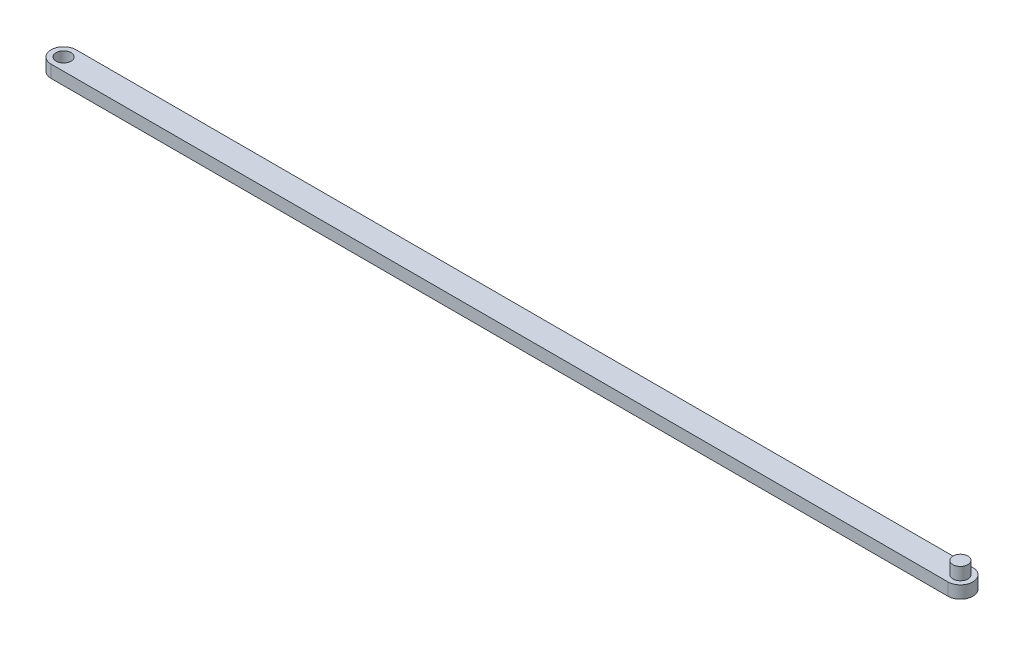
from build123d import *

# Parameters (mm, degrees)
SKETCH_1_R      = 3
EXTRUDE_1_DEPTH = 5
SKETCH_2_R      = 3
EXTRUDE_2_DEPTH = 5


with BuildPart() as part:
    # 草图1 → 凸台-拉伸1 (new body)
    with BuildSketch(Plane(origin=(0, 0, 0), x_dir=(1, 0, 0), z_dir=(0, 1, 0))):
        with BuildLine():
            Line((0, 0), (359.9, 0))
            ThreePointArc((359.9, 0), (364.9, -5), (359.9, -10))
            Line((359.9, -10), (0, -10))
            ThreePointArc((0, -10), (-5, -5), (0, 0))
        make_face()
        with Locations((0, -5)):
            Circle(SKETCH_1_R, mode=Mode.SUBTRACT)
    extrude(amount=EXTRUDE_1_DEPTH)

    # 草图2 → 凸台-拉伸2 (add)
    with BuildSketch(Plane(origin=(0, 5, 0), x_dir=(1, 0, 0), z_dir=(0, 1, 0))):
        with Locations((359.9, -5)):
            Circle(SKETCH_2_R)
    extrude(amount=EXTRUDE_2_DEPTH)


solid = part.part
